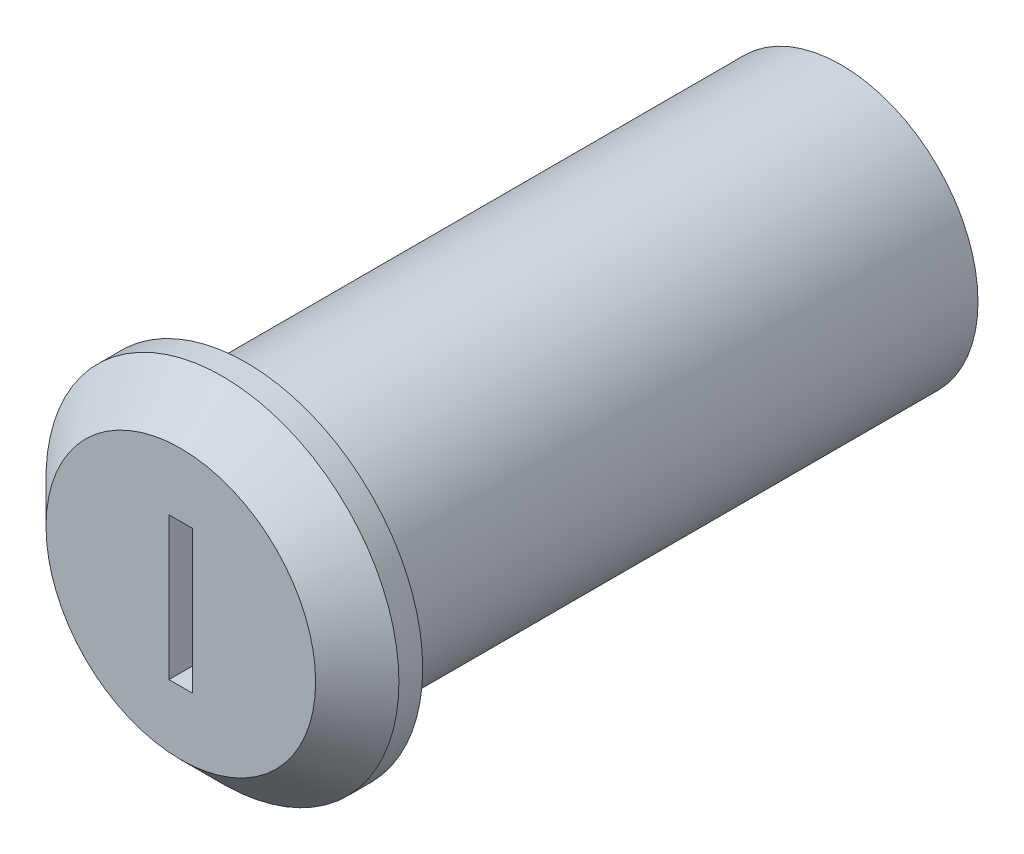
from build123d import *

# Parameters (mm, degrees)
SKETCH1_R           = 5.75
BOSS_EXTRUDE1_DEPTH = 25
SKETCH2_R           = 7.415
BOSS_EXTRUDE2_DEPTH = 1
SKETCH3_R           = 7.415
BOSS_EXTRUDE3_DEPTH = 1.75
BOSS_EXTRUDE3_TAPER = 45
SKETCH4_W           = 1
SKETCH4_H           = 6
CUT_EXTRUDE1_DEPTH  = 1


with BuildPart() as part:
    # Sketch1 → Boss-Extrude1 (new body)
    with BuildSketch(Plane.XY):
        Circle(SKETCH1_R)
    extrude(amount=-BOSS_EXTRUDE1_DEPTH)

    # Sketch2 → Boss-Extrude2 (add)
    with BuildSketch(Plane.XY):
        Circle(SKETCH2_R)
    extrude(amount=BOSS_EXTRUDE2_DEPTH)

    # Sketch3 → Boss-Extrude3 (add)
    with BuildSketch(Plane.XY.offset(1)):
        Circle(SKETCH3_R)
    extrude(amount=BOSS_EXTRUDE3_DEPTH, taper=BOSS_EXTRUDE3_TAPER)

    # Sketch4 → Cut-Extrude1 (cut)
    with BuildSketch(Plane.XY.offset(2.75)):
        Rectangle(SKETCH4_W, SKETCH4_H)
    extrude(amount=-CUT_EXTRUDE1_DEPTH, mode=Mode.SUBTRACT)


solid = part.part
